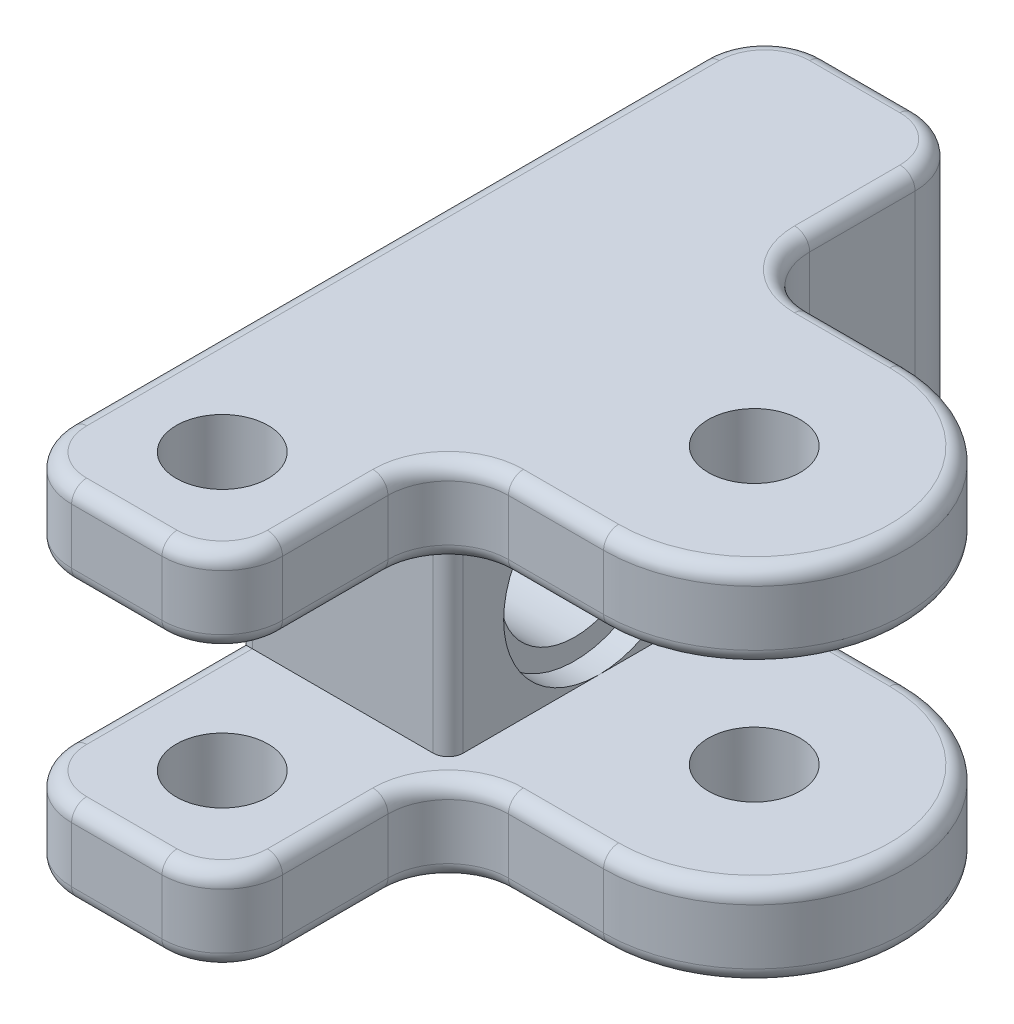
from build123d import *

# Parameters (mm, degrees)
SKETCH2_R           = 1.525
BOSS_EXTRUDE1_DEPTH = 12
SKETCH3_W           = 11.91431853
SKETCH3_H           = 6.3175
CUT_EXTRUDE1_DEPTH  = 12
FILLET2_R           = 2
SKETCH5_R           = 2.475
CUT_EXTRUDE3_DEPTH  = 13
SKETCH6_W           = 7
SKETCH6_H           = 6.3175
CUT_EXTRUDE4_DEPTH  = 7.5
FILLET3_R           = 2
CUT_EXTRUDE5_START  = -0.8
SKETCH8_R           = 3.15875
SKETCH8_R_2         = 2.475
CUT_EXTRUDE5_DEPTH  = 0.8
FILLET8_R           = 0.5


with BuildPart() as part:
    # Sketch2 → Boss-Extrude1 (new body)
    with BuildSketch(Plane(origin=(0, 0, 0), x_dir=(1, 0, 0), z_dir=(0, 1, 0))):
        with BuildLine():
            Line((-5.16, -5), (-5.16, -12.5))
            Line((-5.16, -12.5), (-12.16, -12.5))
            Line((-12.16, -12.5), (-12.16, 12.5))
            Line((-12.16, 12.5), (-5.16, 12.5))
            Line((-5.16, 12.5), (-5.16, 5))
            Line((-5.16, 5), (0, 5))
            ThreePointArc((0, 5), (5, 0), (0, -5))
            Line((0, -5), (-5.16, -5))
        make_face()
        with Locations(Location((0, 0, 0), (0, 0, 270))):
            Circle(SKETCH2_R, mode=Mode.SUBTRACT)
        with Locations(Location((-8.66, -9, 0), (0, 0, 270))):
            Circle(SKETCH2_R, mode=Mode.SUBTRACT)
    extrude(amount=BOSS_EXTRUDE1_DEPTH)

    # Sketch3 → Cut-Extrude1 (cut)
    with BuildSketch(Plane.XY.offset(5)):
        with Locations((0.797159265, 6)):
            Rectangle(SKETCH3_W, SKETCH3_H)
    extrude(amount=-CUT_EXTRUDE1_DEPTH, mode=Mode.SUBTRACT)

    # Fillet2
    fillet2_edges = [part.edges().sort_by_distance(p)[0] for p in [
        (-5.16, 10.579375, 5),
        (-5.16, 10.579375, -5),
        (-5.16, 1.420625, 5),
        (-5.16, 1.420625, -5),
    ]]
    fillet(fillet2_edges, radius=FILLET2_R)

    # Sketch5 → Cut-Extrude3 (cut)
    with BuildSketch(Plane.ZY.offset(12.16)):
        with Locations((0, 6)):
            Circle(SKETCH5_R)
    extrude(amount=-CUT_EXTRUDE3_DEPTH, mode=Mode.SUBTRACT)

    # Sketch6 → Cut-Extrude4 (cut)
    with BuildSketch(Plane.XY.offset(12.5)):
        with Locations((-8.66, 6)):
            Rectangle(SKETCH6_W, SKETCH6_H)
    extrude(amount=-CUT_EXTRUDE4_DEPTH, mode=Mode.SUBTRACT)

    # Fillet3
    fillet3_edges = [part.edges().sort_by_distance(p)[0] for p in [
        (-5.16, 1.420625, 12.5),
        (-12.16, 1.420625, 12.5),
        (-5.16, 10.579375, 12.5),
        (-12.16, 10.579375, 12.5),
        (-12.16, 6, -12.5),
        (-5.16, 6, -12.5),
    ]]
    fillet(fillet3_edges, radius=FILLET3_R)

    # Sketch8 → Cut-Extrude5 (cut)
    with BuildSketch(Plane(origin=(-5.16, 0, 0), x_dir=(0, 0, -1), z_dir=(1, 0, 0)).offset(CUT_EXTRUDE5_START)):
        with Locations((0, 6)):
            Circle(SKETCH8_R)
        with Locations(Location((0, 6, 0), (0, 0, 180))):
            Circle(SKETCH8_R_2, mode=Mode.SUBTRACT)
    extrude(amount=CUT_EXTRUDE5_DEPTH, mode=Mode.SUBTRACT)

    # Fillet8
    # the kernel refuses this fillet: 0.5 mm, written as the material it takes off along each edge
    with BuildSketch(Plane(origin=(-3.16, 0, -5), x_dir=(0, 0, 1), z_dir=(1, 0, 0)), Plane(origin=(-3.16, 2.84125, -5), x_dir=(0, -1, 0), z_dir=(1, 0, 0)), Plane(origin=(0, 2.84125, 5), x_dir=(0, -1, 0), z_dir=(-1, 0, 0)), Plane(origin=(0, 0, 5), x_dir=(0, 0, -1), z_dir=(-1, 0, 0))) as fillet8_piece_1:
        with BuildLine():
            CenterArc((FILLET8_R, -FILLET8_R), FILLET8_R, 90, 90)
            Line((0, -FILLET8_R), (0, 0))
            Line((0, 0), (FILLET8_R, 0))
        make_face()
    extrude(amount=3.16, mode=Mode.SUBTRACT)
    with BuildSketch(Plane(origin=(0, 0, 0), x_dir=(0, 0, -1), z_dir=(-1, 0, 0))) as fillet8_piece_2:
        with BuildLine():
            CenterArc((5 - FILLET8_R, -FILLET8_R), FILLET8_R, 0, 90)
            Line((5, -FILLET8_R), (5, 0))
            Line((5, 0), (5 - FILLET8_R, 0))
        make_face()
    revolve(axis=Axis((0, 0, 0), (0, -1, 0)), revolution_arc=180, mode=Mode.SUBTRACT)
    with BuildSketch(Plane(origin=(-12.16, 2.84125, 5), x_dir=(0, 0, -1), z_dir=(0, 1, 0))) as fillet8_piece_3:
        with BuildLine():
            CenterArc((FILLET8_R, -FILLET8_R), FILLET8_R, 90, 90)
            Line((0, -FILLET8_R), (0, 0))
            Line((0, 0), (FILLET8_R, 0))
        make_face()
    extrude(amount=6.3175, mode=Mode.SUBTRACT)
    with BuildSketch(Plane(origin=(-12.16, 2.84125, 10.5), x_dir=(0, -1, 0), z_dir=(0, 0, -1))) as fillet8_piece_4:
        with BuildLine():
            CenterArc((FILLET8_R, -FILLET8_R), FILLET8_R, 90, 90)
            Line((0, -FILLET8_R), (0, 0))
            Line((0, 0), (FILLET8_R, 0))
        make_face()
    extrude(amount=5.5, mode=Mode.SUBTRACT)
    with BuildSketch(Plane(origin=(-12.16, 9.15875, 10.5), x_dir=(0, 1, 0), z_dir=(0, 0, -1))) as fillet8_piece_5:
        with BuildLine():
            CenterArc((FILLET8_R, FILLET8_R), FILLET8_R, 180, 90)
            Line((0, FILLET8_R), (0, 0))
            Line((0, 0), (FILLET8_R, 0))
        make_face()
    extrude(amount=5.5, mode=Mode.SUBTRACT)
    with BuildSketch(Plane(origin=(-5.16, 9.15875, 5), x_dir=(-1, 0, 0), z_dir=(0, -1, 0))) as fillet8_piece_6:
        with BuildLine():
            CenterArc((FILLET8_R, FILLET8_R), FILLET8_R, 180, 90)
            Line((0, FILLET8_R), (0, 0))
            Line((0, 0), (FILLET8_R, 0))
        make_face()
    extrude(amount=6.3175, mode=Mode.SUBTRACT)
    with BuildSketch(Plane(origin=(-5.16, 9.15875, 10.5), x_dir=(-1, 0, 0), z_dir=(0, 0, -1)), Plane(origin=(-5.16, 2.84125, 10.5), x_dir=(0, -1, 0), z_dir=(0, 0, -1)), Plane(origin=(-5.16, 12, 7), x_dir=(-1, 0, 0), z_dir=(0, 0, 1))) as fillet8_piece_7:
        with BuildLine():
            CenterArc((FILLET8_R, FILLET8_R), FILLET8_R, 180, 90)
            Line((0, FILLET8_R), (0, 0))
            Line((0, 0), (FILLET8_R, 0))
        make_face()
    extrude(amount=3.5, mode=Mode.SUBTRACT)
    with BuildSketch(Plane(origin=(-12.16, 12, 10.5), x_dir=(0, -1, 0), z_dir=(0, 0, -1)), Plane(origin=(-12.16, 0, 10.5), x_dir=(1, 0, 0), z_dir=(0, 0, -1))) as fillet8_piece_8:
        with BuildLine():
            CenterArc((FILLET8_R, -FILLET8_R), FILLET8_R, 90, 90)
            Line((0, -FILLET8_R), (0, 0))
            Line((0, 0), (FILLET8_R, 0))
        make_face()
    extrude(amount=21, mode=Mode.SUBTRACT)
    with BuildSketch(Plane(origin=(-5.16, 0, 7), x_dir=(-1, 0, 0), z_dir=(0, 0, 1)), Plane(origin=(-5.16, 0, -10.5), x_dir=(-1, 0, 0), z_dir=(0, 0, 1)), Plane(origin=(-5.16, 12, -10.5), x_dir=(0, -1, 0), z_dir=(0, 0, 1))) as fillet8_piece_9:
        with BuildLine():
            CenterArc((FILLET8_R, -FILLET8_R), FILLET8_R, 90, 90)
            Line((0, -FILLET8_R), (0, 0))
            Line((0, 0), (FILLET8_R, 0))
        make_face()
    extrude(amount=3.5, mode=Mode.SUBTRACT)
    with BuildSketch(Plane(origin=(-7.16, 0, 12.5), x_dir=(0, 0, -1), z_dir=(-1, 0, 0)), Plane(origin=(-10.16, 0, -12.5), x_dir=(0, 0, 1), z_dir=(1, 0, 0)), Plane(origin=(-10.16, 12, -12.5), x_dir=(0, -1, 0), z_dir=(1, 0, 0)), Plane(origin=(-7.16, 2.84125, 12.5), x_dir=(0, -1, 0), z_dir=(-1, 0, 0))) as fillet8_piece_10:
        with BuildLine():
            CenterArc((FILLET8_R, -FILLET8_R), FILLET8_R, 90, 90)
            Line((0, -FILLET8_R), (0, 0))
            Line((0, 0), (FILLET8_R, 0))
        make_face()
    extrude(amount=3, mode=Mode.SUBTRACT)
    with BuildSketch(Plane(origin=(-10.16, 0, 10.5), x_dir=(0, 0, 1), z_dir=(1, 0, 0))) as fillet8_piece_11:
        with BuildLine():
            CenterArc((2 - FILLET8_R, -FILLET8_R), FILLET8_R, 0, 90)
            Line((2, -FILLET8_R), (2, 0))
            Line((2, 0), (2 - FILLET8_R, 0))
        make_face()
    revolve(axis=Axis((-10.16, 0, 10.5), (0, -1, 0)), revolution_arc=90, mode=Mode.SUBTRACT)
    with BuildSketch(Plane(origin=(-7.16, 0, 10.5), x_dir=(1, 0, 0), z_dir=(0, 0, -1))) as fillet8_piece_12:
        with BuildLine():
            CenterArc((2 - FILLET8_R, -FILLET8_R), FILLET8_R, 0, 90)
            Line((2, -FILLET8_R), (2, 0))
            Line((2, 0), (2 - FILLET8_R, 0))
        make_face()
    revolve(axis=Axis((-7.16, 0, 10.5), (0, -1, 0)), revolution_arc=90, mode=Mode.SUBTRACT)
    with BuildSketch(Plane(origin=(-7.16, 0, -10.5), x_dir=(1, 0, 0), z_dir=(0, 0, 1))) as fillet8_piece_13:
        with BuildLine():
            CenterArc((2 - FILLET8_R, FILLET8_R), FILLET8_R, 270, 90)
            Line((2, FILLET8_R), (2, 0))
            Line((2, 0), (2 - FILLET8_R, 0))
        make_face()
    revolve(axis=Axis((-7.16, 0, -10.5), (0, 1, 0)), revolution_arc=90, mode=Mode.SUBTRACT)
    with BuildSketch(Plane(origin=(-10.16, 0, -10.5), x_dir=(-1, 0, 0), z_dir=(0, 0, 1))) as fillet8_piece_14:
        with BuildLine():
            CenterArc((2 - FILLET8_R, -FILLET8_R), FILLET8_R, 0, 90)
            Line((2, -FILLET8_R), (2, 0))
            Line((2, 0), (2 - FILLET8_R, 0))
        make_face()
    revolve(axis=Axis((-10.16, 0, -10.5), (0, -1, 0)), revolution_arc=90, mode=Mode.SUBTRACT)
    with BuildSketch(Plane(origin=(-7.16, 12, 12.5), x_dir=(0, 0, -1), z_dir=(-1, 0, 0)), Plane(origin=(-10.16, 9.15875, 12.5), x_dir=(0, 0, -1), z_dir=(1, 0, 0))) as fillet8_piece_15:
        with BuildLine():
            CenterArc((FILLET8_R, FILLET8_R), FILLET8_R, 180, 90)
            Line((0, FILLET8_R), (0, 0))
            Line((0, 0), (FILLET8_R, 0))
        make_face()
    extrude(amount=3, mode=Mode.SUBTRACT)
    with BuildSketch(Plane(origin=(-7.16, 12, 10.5), x_dir=(0, 0, 1), z_dir=(-1, 0, 0))) as fillet8_piece_16:
        with BuildLine():
            CenterArc((2 - FILLET8_R, -FILLET8_R), FILLET8_R, 0, 90)
            Line((2, -FILLET8_R), (2, 0))
            Line((2, 0), (2 - FILLET8_R, 0))
        make_face()
    revolve(axis=Axis((-7.16, 12, 10.5), (0, 1, 0)), revolution_arc=90, mode=Mode.SUBTRACT)
    with BuildSketch(Plane(origin=(-10.16, 12, 10.5), x_dir=(-1, 0, 0), z_dir=(0, 0, -1))) as fillet8_piece_17:
        with BuildLine():
            CenterArc((2 - FILLET8_R, -FILLET8_R), FILLET8_R, 0, 90)
            Line((2, -FILLET8_R), (2, 0))
            Line((2, 0), (2 - FILLET8_R, 0))
        make_face()
    revolve(axis=Axis((-10.16, 12, 10.5), (0, 1, 0)), revolution_arc=90, mode=Mode.SUBTRACT)
    with BuildSketch(Plane(origin=(-7.16, 12, -10.5), x_dir=(1, 0, 0), z_dir=(0, 0, 1))) as fillet8_piece_18:
        with BuildLine():
            CenterArc((2 - FILLET8_R, -FILLET8_R), FILLET8_R, 0, 90)
            Line((2 - FILLET8_R, 0), (2, 0))
            Line((2, 0), (2, -FILLET8_R))
        make_face()
    revolve(axis=Axis((-7.16, 12, -10.5), (0, 1, 0)), revolution_arc=90, mode=Mode.SUBTRACT)
    with BuildSketch(Plane(origin=(-10.16, 12, -10.5), x_dir=(-1, 0, 0), z_dir=(0, 0, 1))) as fillet8_piece_19:
        with BuildLine():
            CenterArc((2 - FILLET8_R, FILLET8_R), FILLET8_R, 270, 90)
            Line((2 - FILLET8_R, 0), (2, 0))
            Line((2, 0), (2, FILLET8_R))
        make_face()
    revolve(axis=Axis((-10.16, 12, -10.5), (0, -1, 0)), revolution_arc=90, mode=Mode.SUBTRACT)
    with BuildSketch(Plane(origin=(-7.16, 9.15875, 10.5), x_dir=(0, 0, 1), z_dir=(-1, 0, 0))) as fillet8_piece_20:
        with BuildLine():
            CenterArc((2 - FILLET8_R, FILLET8_R), FILLET8_R, 270, 90)
            Line((2, FILLET8_R), (2, 0))
            Line((2, 0), (2 - FILLET8_R, 0))
        make_face()
    revolve(axis=Axis((-7.16, 9.15875, 10.5), (0, 1, 0)), revolution_arc=90, mode=Mode.SUBTRACT)
    with BuildSketch(Plane(origin=(-10.16, 9.15875, 10.5), x_dir=(-1, 0, 0), z_dir=(0, 0, -1))) as fillet8_piece_21:
        with BuildLine():
            CenterArc((2 - FILLET8_R, FILLET8_R), FILLET8_R, 270, 90)
            Line((2 - FILLET8_R, 0), (2, 0))
            Line((2, 0), (2, FILLET8_R))
        make_face()
    revolve(axis=Axis((-10.16, 9.15875, 10.5), (0, 1, 0)), revolution_arc=90, mode=Mode.SUBTRACT)
    with BuildSketch(Plane(origin=(-10.16, 2.84125, 10.5), x_dir=(0, 0, 1), z_dir=(1, 0, 0))) as fillet8_piece_22:
        with BuildLine():
            CenterArc((2 - FILLET8_R, FILLET8_R), FILLET8_R, 270, 90)
            Line((2 - FILLET8_R, 0), (2, 0))
            Line((2, 0), (2, FILLET8_R))
        make_face()
    revolve(axis=Axis((-10.16, 2.84125, 10.5), (0, -1, 0)), revolution_arc=90, mode=Mode.SUBTRACT)
    with BuildSketch(Plane(origin=(-7.16, 2.84125, 10.5), x_dir=(1, 0, 0), z_dir=(0, 0, -1))) as fillet8_piece_23:
        with BuildLine():
            CenterArc((2 - FILLET8_R, FILLET8_R), FILLET8_R, 270, 90)
            Line((2 - FILLET8_R, 0), (2, 0))
            Line((2, 0), (2, FILLET8_R))
        make_face()
    revolve(axis=Axis((-7.16, 2.84125, 10.5), (0, -1, 0)), revolution_arc=90, mode=Mode.SUBTRACT)
    with BuildSketch(Plane(origin=(0, 2.84125, 0), x_dir=(0, 0, -1), z_dir=(-1, 0, 0))) as fillet8_piece_24:
        with BuildLine():
            CenterArc((5 - FILLET8_R, FILLET8_R), FILLET8_R, 270, 90)
            Line((5 - FILLET8_R, 0), (5, 0))
            Line((5, 0), (5, FILLET8_R))
        make_face()
    revolve(axis=Axis((0, 2.84125, 0), (0, -1, 0)), revolution_arc=180, mode=Mode.SUBTRACT)
    with BuildSketch(Plane(origin=(0, 9.15875, 0), x_dir=(0, 0, -1), z_dir=(-1, 0, 0))) as fillet8_piece_25:
        with BuildLine():
            CenterArc((5 - FILLET8_R, -FILLET8_R), FILLET8_R, 0, 90)
            Line((5, -FILLET8_R), (5, 0))
            Line((5, 0), (5 - FILLET8_R, 0))
        make_face()
    revolve(axis=Axis((0, 9.15875, 0), (0, -1, 0)), revolution_arc=180, mode=Mode.SUBTRACT)
    with BuildSketch(Plane(origin=(0, 9.15875, -5), x_dir=(0, 0, 1), z_dir=(-1, 0, 0)), Plane(origin=(-3.16, 9.15875, 5), x_dir=(0, 0, -1), z_dir=(1, 0, 0)), Plane(origin=(0, 12, 5), x_dir=(0, 0, -1), z_dir=(-1, 0, 0)), Plane(origin=(-3.16, 12, -5), x_dir=(0, 0, 1), z_dir=(1, 0, 0))) as fillet8_piece_26:
        with BuildLine():
            CenterArc((FILLET8_R, FILLET8_R), FILLET8_R, 180, 90)
            Line((0, FILLET8_R), (0, 0))
            Line((0, 0), (FILLET8_R, 0))
        make_face()
    extrude(amount=3.16, mode=Mode.SUBTRACT)
    with BuildSketch(Plane(origin=(0, 12, 0), x_dir=(0, 0, -1), z_dir=(-1, 0, 0))) as fillet8_piece_27:
        with BuildLine():
            CenterArc((5 - FILLET8_R, FILLET8_R), FILLET8_R, 270, 90)
            Line((5, FILLET8_R), (5, 0))
            Line((5, 0), (5 - FILLET8_R, 0))
        make_face()
    revolve(axis=Axis((0, 12, 0), (0, -1, 0)), revolution_arc=180, mode=Mode.SUBTRACT)
    with BuildSketch(Plane(origin=(-3.16, 9.15875, -7), x_dir=(-0.48631676857152506, 0, -0.87378258199975), z_dir=(0.87378258199975, 0, -0.48631676857152506))) as fillet8_piece_28_section:
        with BuildLine():
            CenterArc((2 + FILLET8_R, FILLET8_R), FILLET8_R, 180, 90)
            Line((2, FILLET8_R), (2, 0))
            Line((2, 0), (2 + FILLET8_R, 0))
        make_face()
    fillet8_piece_28 = revolve(axis=Axis((-3.16, 9.15875, -7), (0, 1, 0)), revolution_arc=150.901220426, mode=Mode.PRIVATE)
    fillet8_piece_28 = split(fillet8_piece_28, bisect_by=Plane(origin=(-5.16, 9.15875, -7), z_dir=(1, 0, 0)), keep=Keep.TOP, mode=Mode.PRIVATE)
    add(fillet8_piece_28, mode=Mode.SUBTRACT)
    with BuildSketch(Plane(origin=(-3.16, 12, -7), x_dir=(-1, 0, 0), z_dir=(0, 0, -1))) as fillet8_piece_29:
        with BuildLine():
            CenterArc((2 + FILLET8_R, -FILLET8_R), FILLET8_R, 90, 90)
            Line((2, -FILLET8_R), (2, 0))
            Line((2, 0), (2 + FILLET8_R, 0))
        make_face()
    revolve(axis=Axis((-3.16, 12, -7), (0, 1, 0)), revolution_arc=90, mode=Mode.SUBTRACT)
    with BuildSketch(Plane(origin=(-3.16, 0, -7), x_dir=(-1, 0, 0), z_dir=(0, 0, -1))) as fillet8_piece_30:
        with BuildLine():
            CenterArc((2 + FILLET8_R, FILLET8_R), FILLET8_R, 180, 90)
            Line((2, FILLET8_R), (2, 0))
            Line((2, 0), (2 + FILLET8_R, 0))
        make_face()
    revolve(axis=Axis((-3.16, 0, -7), (0, 1, 0)), revolution_arc=90, mode=Mode.SUBTRACT)
    with BuildSketch(Plane(origin=(-3.16, 2.84125, -7), x_dir=(-0.48631676857152506, 0, -0.87378258199975), z_dir=(0.87378258199975, 0, -0.48631676857152506))) as fillet8_piece_31_section:
        with BuildLine():
            CenterArc((2 + FILLET8_R, -FILLET8_R), FILLET8_R, 90, 90)
            Line((2 + FILLET8_R, 0), (2, 0))
            Line((2, 0), (2, -FILLET8_R))
        make_face()
    fillet8_piece_31 = revolve(axis=Axis((-3.16, 2.84125, -7), (0, 1, 0)), revolution_arc=150.901220426, mode=Mode.PRIVATE)
    fillet8_piece_31 = split(fillet8_piece_31, bisect_by=Plane(origin=(-5.16, 2.84125, -7), z_dir=(1, 0, 0)), keep=Keep.TOP, mode=Mode.PRIVATE)
    add(fillet8_piece_31, mode=Mode.SUBTRACT)
    with BuildSketch(Plane(origin=(-3.16, 9.15875, 7), x_dir=(-1, 0, 0), z_dir=(0, 0, 1))) as fillet8_piece_32:
        with BuildLine():
            CenterArc((2 + FILLET8_R, -FILLET8_R), FILLET8_R, 90, 90)
            Line((2, -FILLET8_R), (2, 0))
            Line((2, 0), (2 + FILLET8_R, 0))
        make_face()
    revolve(axis=Axis((-3.16, 9.15875, 7), (0, -1, 0)), revolution_arc=90, mode=Mode.SUBTRACT)
    with BuildSketch(Plane(origin=(-3.16, 12, 7), x_dir=(-1, 0, 0), z_dir=(0, 0, 1))) as fillet8_piece_33:
        with BuildLine():
            CenterArc((2 + FILLET8_R, FILLET8_R), FILLET8_R, 180, 90)
            Line((2, FILLET8_R), (2, 0))
            Line((2, 0), (2 + FILLET8_R, 0))
        make_face()
    revolve(axis=Axis((-3.16, 12, 7), (0, -1, 0)), revolution_arc=90, mode=Mode.SUBTRACT)
    with BuildSketch(Plane(origin=(-3.16, 0, 7), x_dir=(0, 0, -1), z_dir=(1, 0, 0))) as fillet8_piece_34:
        with BuildLine():
            CenterArc((2 + FILLET8_R, FILLET8_R), FILLET8_R, 180, 90)
            Line((2, FILLET8_R), (2, 0))
            Line((2, 0), (2 + FILLET8_R, 0))
        make_face()
    revolve(axis=Axis((-3.16, 0, 7), (0, 1, 0)), revolution_arc=90, mode=Mode.SUBTRACT)
    with BuildSketch(Plane(origin=(-3.16, 2.84125, 7), x_dir=(0, 0, -1), z_dir=(1, 0, 0))) as fillet8_piece_35:
        with BuildLine():
            CenterArc((2 + FILLET8_R, -FILLET8_R), FILLET8_R, 90, 90)
            Line((2 + FILLET8_R, 0), (2, 0))
            Line((2, 0), (2, -FILLET8_R))
        make_face()
    revolve(axis=Axis((-3.16, 2.84125, 7), (0, 1, 0)), revolution_arc=90, mode=Mode.SUBTRACT)
    with BuildSketch(Plane(origin=(-12.16, 2.84125, 10.5), x_dir=(0, -1, 0), z_dir=(0, 0, -1))) as fillet8_piece_36a_section:
        with BuildLine():
            CenterArc((FILLET8_R, -FILLET8_R), FILLET8_R, 90, 90)
            Line((0, -FILLET8_R), (0, 0))
            Line((0, 0), (FILLET8_R, 0))
        make_face()
    fillet8_piece_36a = extrude(amount=6.75, mode=Mode.PRIVATE)
    fillet8_piece_36a = split(fillet8_piece_36a, bisect_by=Plane(origin=(-12.16, 2.84125, 5), z_dir=(0, 0, -1)), keep=Keep.TOP, mode=Mode.PRIVATE)
    with BuildSketch(Plane(origin=(-12.16, 1.59125, 5), x_dir=(0, 0, -1), z_dir=(0, 1, 0))) as fillet8_piece_36b_section:
        with BuildLine():
            CenterArc((FILLET8_R, -FILLET8_R), FILLET8_R, 90, 90)
            Line((0, -FILLET8_R), (0, 0))
            Line((0, 0), (FILLET8_R, 0))
        make_face()
    fillet8_piece_36b = extrude(amount=7.5675, mode=Mode.PRIVATE)
    fillet8_piece_36b = split(fillet8_piece_36b, bisect_by=Plane(origin=(-12.16, 2.84125, 5), z_dir=(0, -1, 0)), keep=Keep.TOP, mode=Mode.PRIVATE)
    fillet8_piece_36 = fillet8_piece_36a & fillet8_piece_36b
    add(fillet8_piece_36, mode=Mode.SUBTRACT)
    with BuildSketch(Plane(origin=(-12.16, 2.84125, 5), x_dir=(0, 0, -1), z_dir=(0, 1, 0))) as fillet8_piece_37a_section:
        with BuildLine():
            CenterArc((FILLET8_R, -FILLET8_R), FILLET8_R, 90, 90)
            Line((0, -FILLET8_R), (0, 0))
            Line((0, 0), (FILLET8_R, 0))
        make_face()
    fillet8_piece_37a = extrude(amount=7.5675, mode=Mode.PRIVATE)
    fillet8_piece_37a = split(fillet8_piece_37a, bisect_by=Plane(origin=(-12.16, 9.15875, 5), z_dir=(0, 1, 0)), keep=Keep.TOP, mode=Mode.PRIVATE)
    with BuildSketch(Plane(origin=(-12.16, 9.15875, 10.5), x_dir=(0, 1, 0), z_dir=(0, 0, -1))) as fillet8_piece_37b_section:
        with BuildLine():
            CenterArc((FILLET8_R, FILLET8_R), FILLET8_R, 180, 90)
            Line((0, FILLET8_R), (0, 0))
            Line((0, 0), (FILLET8_R, 0))
        make_face()
    fillet8_piece_37b = extrude(amount=6.75, mode=Mode.PRIVATE)
    fillet8_piece_37b = split(fillet8_piece_37b, bisect_by=Plane(origin=(-12.16, 9.15875, 5), z_dir=(0, 0, -1)), keep=Keep.TOP, mode=Mode.PRIVATE)
    fillet8_piece_37 = fillet8_piece_37a & fillet8_piece_37b
    add(fillet8_piece_37, mode=Mode.SUBTRACT)


solid = part.part
